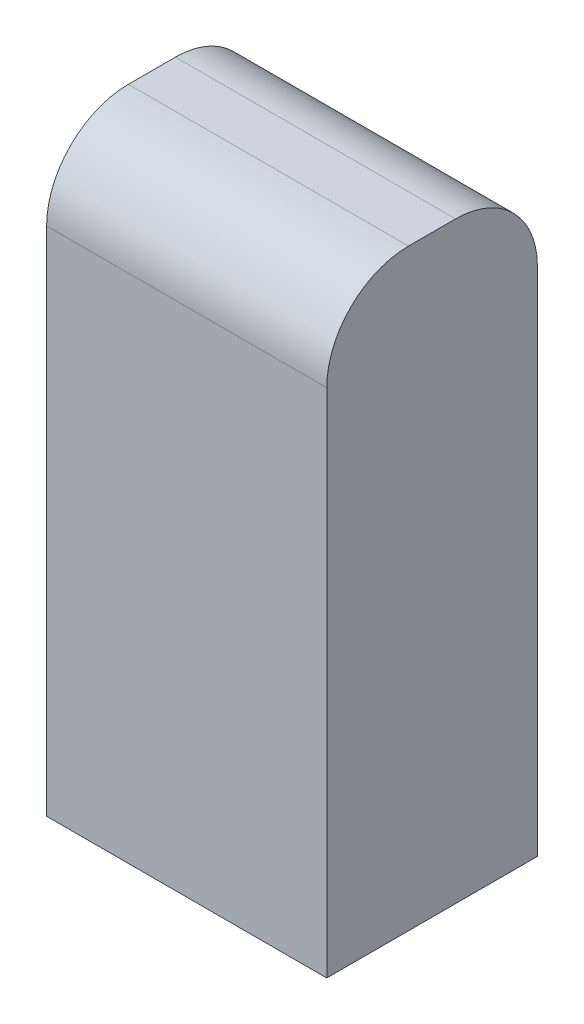
from build123d import *

# Parameters (mm, degrees)
SKETCH1_W           = 34.798
SKETCH1_H           = 26.162
BOSS_EXTRUDE1_DEPTH = 73.66
FILLET1_R           = 10.16


with BuildPart() as part:
    # Sketch1 → Boss-Extrude1 (new body)
    with BuildSketch(Plane(origin=(0, 0, 0), x_dir=(1, 0, 0), z_dir=(0, 1, 0))):
        Rectangle(SKETCH1_W, SKETCH1_H)
    extrude(amount=BOSS_EXTRUDE1_DEPTH)

    # Fillet1
    fillet1_edges = [part.edges().sort_by_distance(p)[0] for p in [
        (0, 73.66, -13.081),
        (0, 73.66, 13.081),
    ]]
    fillet(fillet1_edges, radius=FILLET1_R)


solid = part.part
